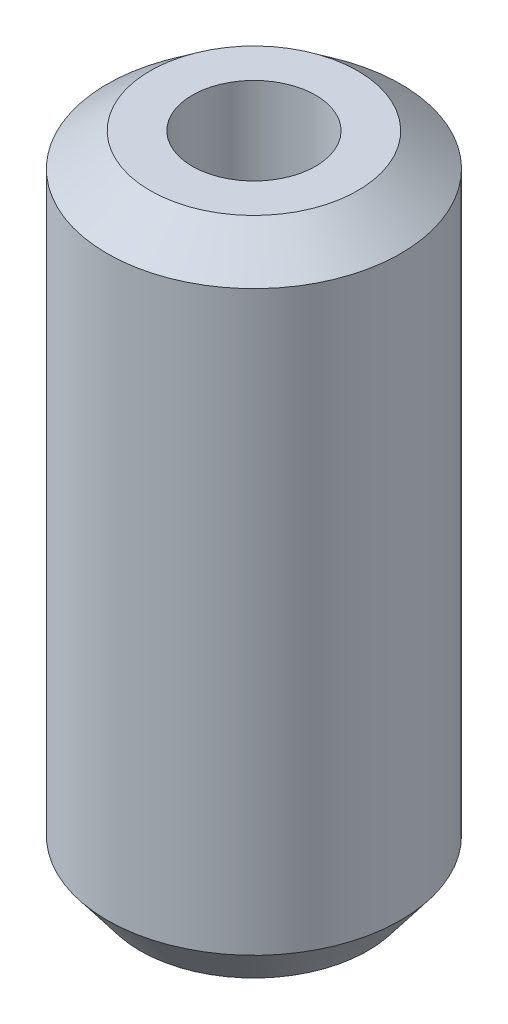
from build123d import *
from OCP.BRepFilletAPI import BRepFilletAPI_MakeChamfer

# Parameters (mm, degrees)
SKETCH1_R           = 10
BOSS_EXTRUDE1_DEPTH = 44.510007285
SKETCH2_R           = 4.199580832
CUT_EXTRUDE1_DEPTH  = 47.702684596
CHAMFER1_SIZE       = 2.24781699
CHAMFER1_SIZE2      = 2.929204041


with BuildPart() as part:
    # Sketch1 → Boss-Extrude1 (new body)
    with BuildSketch(Plane(origin=(0, 0, 0), x_dir=(1, 0, 0), z_dir=(0, 1, 0))):
        Circle(SKETCH1_R)
    extrude(amount=BOSS_EXTRUDE1_DEPTH)

    # Sketch2 → Cut-Extrude1 (cut, through all)
    with BuildSketch(Plane(origin=(0, 0, 0), x_dir=(1, 0, 0), z_dir=(0, 1, 0))):
        Circle(SKETCH2_R)
    extrude(amount=CUT_EXTRUDE1_DEPTH, mode=Mode.SUBTRACT)

    # Chamfer1: one chamfer whose edges measure the first distance from different faces: ONE call of the kernel's chamfer builder (chamfer() names one face for all edges)
    chamfer1_edges_1 = [part.edges().sort_by_distance(p)[0] for p in [
        (-10, 44.510007285, 0),
    ]]
    chamfer1_side_1 = [part.faces().sort_by_distance(p)[0] for p in [
        (-10, 22.255003642, 0),
    ]]
    chamfer1_edges_2 = [part.edges().sort_by_distance(p)[0] for p in [
        (-10, 0, 0),
    ]]
    chamfer1_side_2 = [part.faces().sort_by_distance(p)[0] for p in [
        (-9.717157288, 0, 0),
    ]]
    chamfer1 = BRepFilletAPI_MakeChamfer(part.part.solid().wrapped)
    for e in chamfer1_edges_1:
        chamfer1.Add(CHAMFER1_SIZE, CHAMFER1_SIZE2, e.wrapped, chamfer1_side_1[0].wrapped)  # the first distance lies on this face
    for e in chamfer1_edges_2:
        chamfer1.Add(CHAMFER1_SIZE, CHAMFER1_SIZE2, e.wrapped, chamfer1_side_2[0].wrapped)  # the first distance lies on this face
    add(Compound.cast(chamfer1.Shape()), mode=Mode.REPLACE)


solid = part.part
